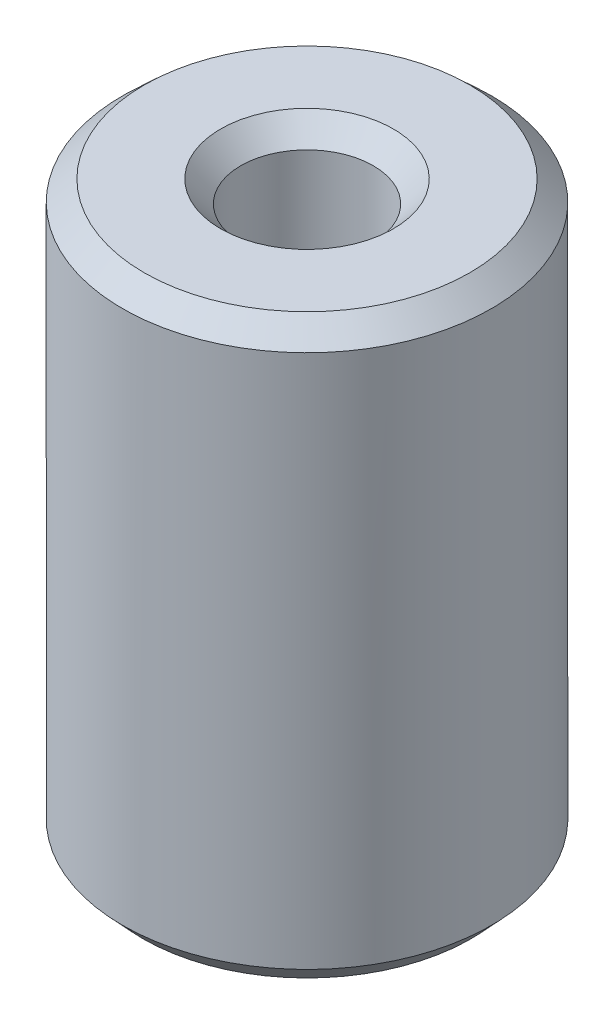
from build123d import *
from OCP.BRepFilletAPI import BRepFilletAPI_MakeChamfer

# Parameters (mm, degrees)
SKETCH1_R           = 15
BOSS_EXTRUDE1_DEPTH = 46.848746457
SKETCH2_R           = 5.388094701
CUT_EXTRUDE1_DEPTH  = 52.427668084
CHAMFER1_SIZE       = 1.643599493
CHAMFER1_SIZE2      = 1.764242629


with BuildPart() as part:
    # Sketch1 → Boss-Extrude1 (new body)
    with BuildSketch(Plane(origin=(0, 0, 0), x_dir=(1, 0, 0), z_dir=(0, 1, 0))):
        Circle(SKETCH1_R)
    extrude(amount=BOSS_EXTRUDE1_DEPTH)

    # Sketch2 → Cut-Extrude1 (cut, through all)
    with BuildSketch(Plane(origin=(0, 0, 0), x_dir=(1, 0, 0), z_dir=(0, 1, 0))):
        Circle(SKETCH2_R)
    extrude(amount=CUT_EXTRUDE1_DEPTH, mode=Mode.SUBTRACT)

    # Chamfer1: one chamfer whose edges measure the first distance from different faces: ONE call of the kernel's chamfer builder (chamfer() names one face for all edges)
    chamfer1_edges_1 = [part.edges().sort_by_distance(p)[0] for p in [
        (-5.388094701, 46.848746457, 0),
    ]]
    chamfer1_side_1 = [part.faces().sort_by_distance(p)[0] for p in [
        (-14.575735931, 46.848746457, 0),
    ]]
    chamfer1_edges_2 = [part.edges().sort_by_distance(p)[0] for p in [
        (-5.388094701, 0, 0),
    ]]
    chamfer1_side_2 = [part.faces().sort_by_distance(p)[0] for p in [
        (-5.388094701, 23.424373229, 0),
    ]]
    chamfer1_edges_3 = [part.edges().sort_by_distance(p)[0] for p in [
        (-15, 0, 0),
    ]]
    chamfer1_side_3 = [part.faces().sort_by_distance(p)[0] for p in [
        (-14.575735931, 0, 0),
    ]]
    chamfer1_edges_4 = [part.edges().sort_by_distance(p)[0] for p in [
        (-15, 46.848746457, 0),
    ]]
    chamfer1_side_4 = [part.faces().sort_by_distance(p)[0] for p in [
        (-15, 23.424373229, 0),
    ]]
    chamfer1 = BRepFilletAPI_MakeChamfer(part.part.solid().wrapped)
    for e in chamfer1_edges_1:
        chamfer1.Add(CHAMFER1_SIZE, CHAMFER1_SIZE2, e.wrapped, chamfer1_side_1[0].wrapped)  # the first distance lies on this face
    for e in chamfer1_edges_2:
        chamfer1.Add(CHAMFER1_SIZE, CHAMFER1_SIZE2, e.wrapped, chamfer1_side_2[0].wrapped)  # the first distance lies on this face
    for e in chamfer1_edges_3:
        chamfer1.Add(CHAMFER1_SIZE, CHAMFER1_SIZE2, e.wrapped, chamfer1_side_3[0].wrapped)  # the first distance lies on this face
    for e in chamfer1_edges_4:
        chamfer1.Add(CHAMFER1_SIZE, CHAMFER1_SIZE2, e.wrapped, chamfer1_side_4[0].wrapped)  # the first distance lies on this face
    add(Compound.cast(chamfer1.Shape()), mode=Mode.REPLACE)


solid = part.part
